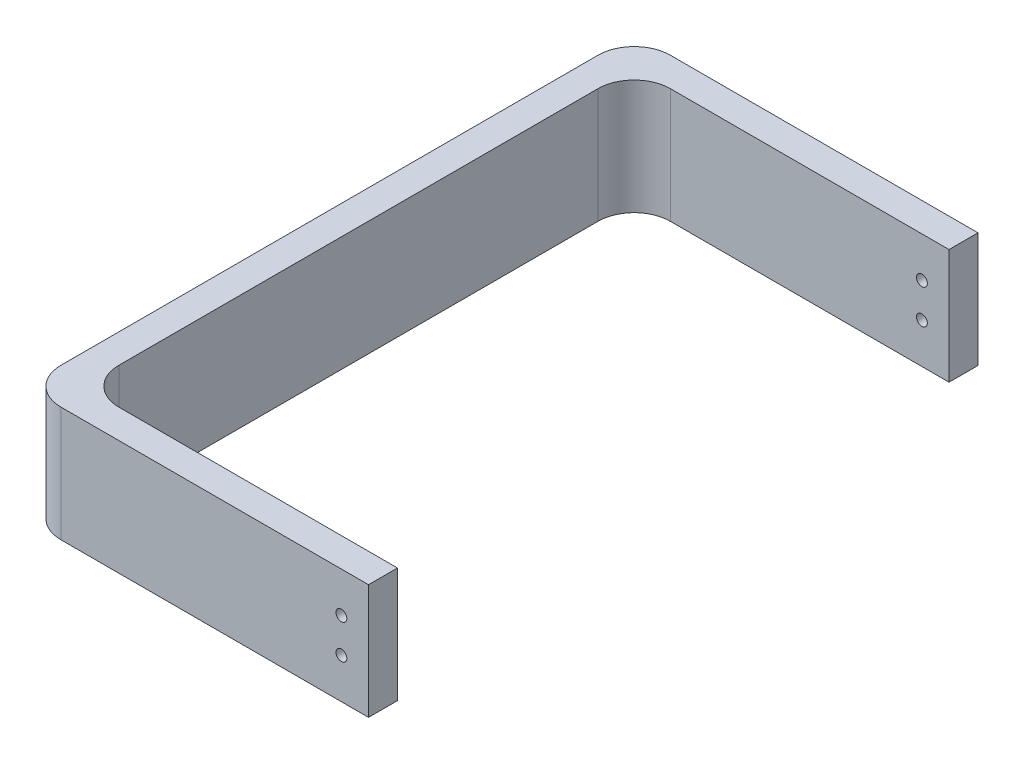
from build123d import *

# Parameters (mm, degrees)
BOSS_EXTRUDE1_DEPTH = 31.75
SKETCH2_R           = 1.5
CUT_EXTRUDE1_DEPTH  = 196.937802631
FILLET1_R           = 10


with BuildPart() as part:
    # Sketch1 → Boss-Extrude1 (new body)
    with BuildSketch(Plane(origin=(0, 0, 0), x_dir=(1, 0, 0), z_dir=(0, 1, 0))):
        Polygon((0, 0), (-95, 0), (-95, 168.4), (0, 168.4), (0, 160.4), (-87, 160.4), (-87, 8), (0, 8), align=None)
    extrude(amount=BOSS_EXTRUDE1_DEPTH)

    # Sketch2 → Cut-Extrude1 (cut, through all)
    with BuildSketch(Plane.XY):
        with Locations((-7.5, 20.6375)):
            Circle(SKETCH2_R)
        with Locations((-7.5, 11.1125)):
            Circle(SKETCH2_R)
    extrude(amount=-CUT_EXTRUDE1_DEPTH, mode=Mode.SUBTRACT)

    # Fillet1
    fillet1_edges = [part.edges().sort_by_distance(p)[0] for p in [
        (-95, 15.875, -168.4),
        (-87, 15.875, -160.4),
        (-87, 15.875, -8),
        (-95, 15.875, 0),
    ]]
    fillet(fillet1_edges, radius=FILLET1_R)


solid = part.part
